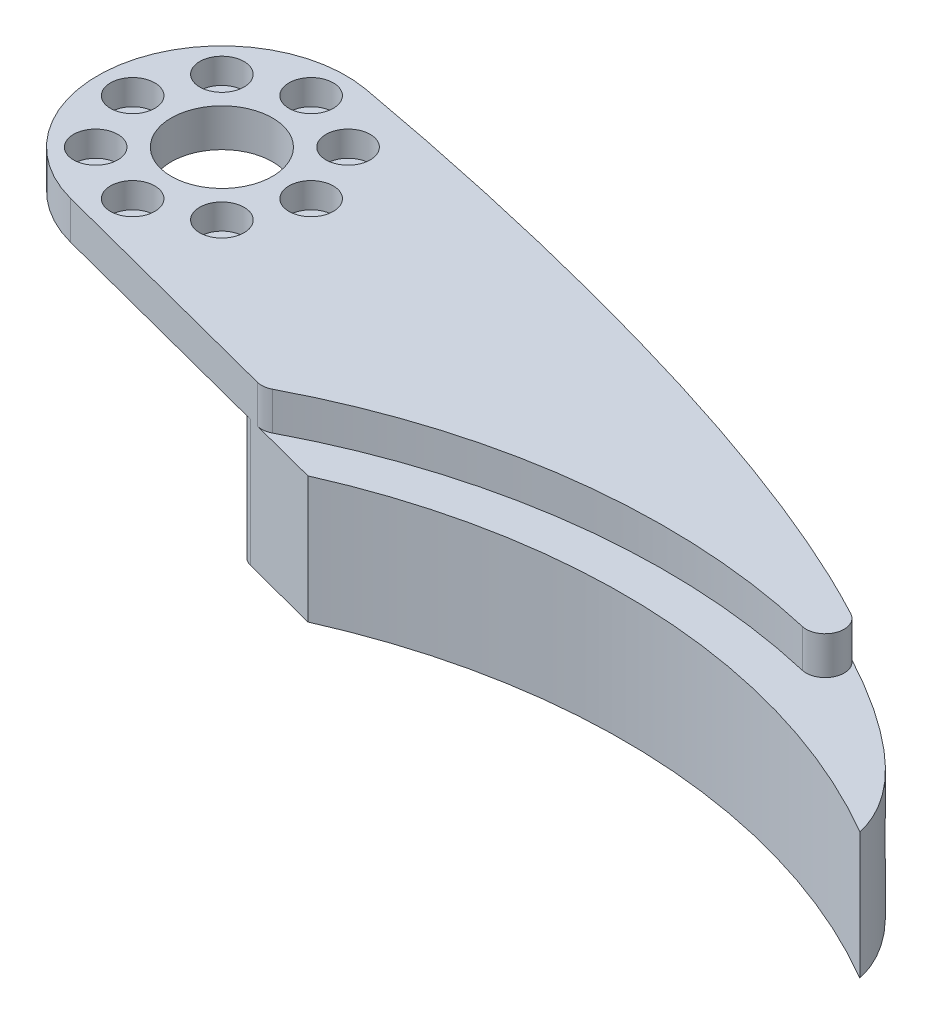
from build123d import *

# Parameters (mm, degrees)
SKETCH1_R           = 1
SKETCH1_R_2         = 4
BOSS_EXTRUDE1_DEPTH = 3
BOSS_EXTRUDE2_START = -10
BOSS_EXTRUDE2_DEPTH = 10
SKETCH2_R           = 1.75
CUT_EXTRUDE1_DEPTH  = 2
FILLET1_DEPTH       = 4
FILLET1_START       = -10
FILLET1_2_DEPTH     = 10


with BuildPart() as part:
    # Sketch1 → Boss-Extrude1 (new body)
    with BuildSketch(Plane(origin=(0, 0, 0), x_dir=(1, 0, 0), z_dir=(0, 1, 0))):
        with BuildLine():
            ThreePointArc((18.051481703, -14.829547427), (41.662522, -8.486422092), (65.646603069, -13.227763489))
            add(Edge.make_bspline(
                [(65.646603069, -13.227763489), (56.529791546, -4.297397801), (30.90013189, 4.342634152), (1.753021735, 9.641935221)],
                knots=[0.6061191, 0.6061191, 0.6061191, 0.6061191, 1.438179848, 1.438179848, 1.438179848, 1.438179848], degree=3))
            ThreePointArc((1.753021735, 9.641935221), (-9.569441867, 2.113239778), (-2.470487043, -9.483495862))
            Line((-2.470487043, -9.483495862), (18.051481703, -14.829547427))
        make_face()
        with Locations(Location((0, 7.05, 0), (0, 0, 270))):
            Circle(SKETCH1_R, mode=Mode.SUBTRACT)
        with Locations(Location((0, -7.05, 0), (0, 0, 270))):
            Circle(SKETCH1_R, mode=Mode.SUBTRACT)
        with Locations(Location((-4.985102807, -4.985102807, 0), (0, 0, 270))):
            Circle(SKETCH1_R, mode=Mode.SUBTRACT)
        with Locations(Location((4.985102807, -4.985102807, 0), (0, 0, 270))):
            Circle(SKETCH1_R, mode=Mode.SUBTRACT)
        with Locations(Location((-7.05, 0, 0), (0, 0, 270))):
            Circle(SKETCH1_R, mode=Mode.SUBTRACT)
        with Locations(Location((0, 0, 0), (0, 0, 270))):
            Circle(SKETCH1_R_2, mode=Mode.SUBTRACT)
        with Locations(Location((7.05, 0, 0), (0, 0, 270))):
            Circle(SKETCH1_R, mode=Mode.SUBTRACT)
        with Locations(Location((-4.985102807, 4.985102807, 0), (0, 0, 270))):
            Circle(SKETCH1_R, mode=Mode.SUBTRACT)
        with Locations(Location((4.985102807, 4.985102807, 0), (0, 0, 270))):
            Circle(SKETCH1_R, mode=Mode.SUBTRACT)
    extrude(amount=BOSS_EXTRUDE1_DEPTH)

    # Sketch1<3> → Boss-Extrude2 (add)
    with BuildSketch(Plane(origin=(0, 0, 0), x_dir=(1, 0, 0), z_dir=(0, 1, 0)).offset(BOSS_EXTRUDE2_START)):
        with BuildLine():
            Line((18.051481703, -14.829547427), (22.89, -16.09))
            ThreePointArc((22.89, -16.09), (46.274614562, -11.793991127), (69.041958929, -18.64555452))
            add(Edge.make_bspline(
                [(65.646603069, -13.227763489), (67.486697691, -15.030226755), (68.654100184, -16.844517492), (69.041958929, -18.64555452)],
                knots=[0.832060748, 0.832060748, 0.832060748, 0.832060748, 1, 1, 1, 1], degree=3))
            ThreePointArc((65.646603069, -13.227763489), (41.662522, -8.486422092), (18.051481703, -14.829547427))
        make_face()
        with BuildLine():
            Line((13.212963406, -13.569094854), (18.051481703, -14.829547427))
            ThreePointArc((18.051481703, -14.829547427), (41.662522, -8.486422092), (65.646603069, -13.227763489))
            add(Edge.make_bspline(
                [(54.827143585, -6.078086241), (59.477760605, -8.399185567), (63.170981642, -10.802770431), (65.646603069, -13.227763489)],
                knots=[0.6061191, 0.6061191, 0.6061191, 0.6061191, 0.832060748, 0.832060748, 0.832060748, 0.832060748], degree=3))
            ThreePointArc((54.827143585, -6.078086241), (33.305217678, -5.852522289), (13.212963406, -13.569094854))
        make_face()
    extrude(amount=BOSS_EXTRUDE2_DEPTH)

    # Sketch2 → Cut-Extrude1 (cut)
    with BuildSketch(Plane(origin=(0, 3, 0), x_dir=(1, 0, 0), z_dir=(0, 1, 0))):
        with Locations(Location((0, 7.05, 0), (0, 0, 270))):
            Circle(SKETCH2_R)
        with Locations(Location((4.985102807, 4.985102807, 0), (0, 0, 270))):
            Circle(SKETCH2_R)
        with Locations(Location((7.05, 0, 0), (0, 0, 270))):
            Circle(SKETCH2_R)
        with Locations(Location((4.985102807, -4.985102807, 0), (0, 0, 270))):
            Circle(SKETCH2_R)
        with Locations(Location((0, -7.05, 0), (0, 0, 270))):
            Circle(SKETCH2_R)
        with Locations(Location((-4.985102807, -4.985102807, 0), (0, 0, 270))):
            Circle(SKETCH2_R)
        with Locations(Location((-7.05, 0, 0), (0, 0, 270))):
            Circle(SKETCH2_R)
        with Locations(Location((-4.985102807, 4.985102807, 0), (0, 0, 270))):
            Circle(SKETCH2_R)
    extrude(amount=-CUT_EXTRUDE1_DEPTH, mode=Mode.SUBTRACT)

    # Fillet1: read off the stored shape, not the designer's step
    # Fillet1 outline → Fillet1 (cut)
    with BuildSketch(Plane(origin=(0, 0, 0), x_dir=(1, 0, 0), z_dir=(0, 1, 0))):
        with BuildLine():
            add(Edge.make_bspline(
                [(56.770531977, -7.082884332), (60.513292136, -9.089900017), (63.526462064, -11.150981005), (65.646603069, -13.227763489)],
                knots=[0.638562604, 0.638562604, 0.638562604, 0.638562604, 0.832060748, 0.832060748, 0.832060748, 0.832060748], degree=3))
            ThreePointArc((56.770531977, -7.082884332), (57.465125309, -8.934236095), (55.720831584, -9.865580632))
            ThreePointArc((55.720831584, -9.865580632), (60.765635031, -11.304836191), (65.646603069, -13.227763489))
        make_face()
        with BuildLine():
            ThreePointArc((18.559470243, -14.56123833), (18.034960356, -14.721619309), (17.487859224, -14.682721609))
            Line((17.487859224, -14.682721609), (18.051481703, -14.829547427))
            ThreePointArc((18.051481703, -14.829547427), (18.305118454, -14.69471599), (18.559470243, -14.56123833))
        make_face()
    extrude(amount=FILLET1_DEPTH, mode=Mode.SUBTRACT)

    # Fillet1 2 outline → Fillet1 2 (cut)
    with BuildSketch(Plane(origin=(0, 0, 0), x_dir=(1, 0, 0), z_dir=(0, 1, 0)).offset(FILLET1_START)):
        with BuildLine():
            ThreePointArc((54.827143585, -6.078086241), (54.727119613, -6.058000301), (54.627060101, -6.038092157))
            ThreePointArc((54.627060101, -6.038092157), (54.822409803, -6.090686613), (55.008905492, -6.169089678))
            add(Edge.make_bspline(
                [(54.827143585, -6.078086241), (54.887894452, -6.10840669), (54.948481948, -6.138741214), (55.008905492, -6.169089678)],
                knots=[0.6061191, 0.6061191, 0.6061191, 0.6061191, 0.609070569, 0.609070569, 0.609070569, 0.609070569], degree=3))
        make_face()
        with BuildLine():
            ThreePointArc((16.754219894, -14.49160575), (15.642770878, -13.216507508), (16.425540404, -11.717018824))
            ThreePointArc((16.425540404, -11.717018824), (14.804293031, -12.617109451), (13.212963406, -13.569094854))
            Line((13.212963406, -13.569094854), (16.754219894, -14.49160575))
        make_face()
    extrude(amount=FILLET1_2_DEPTH, mode=Mode.SUBTRACT)


solid = part.part
